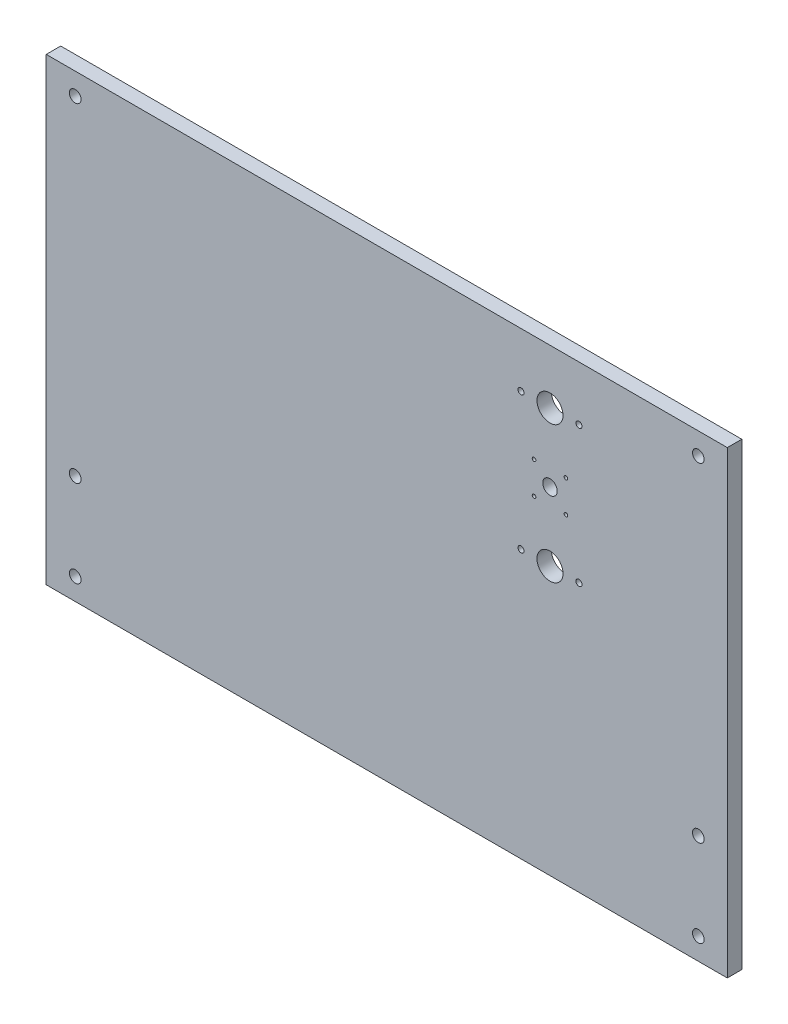
from build123d import *

# Parameters (mm, degrees)
SKETCH2_W             = 470
SKETCH2_H             = 317
BOSS_EXTRUDE1_DEPTH   = 5
SKETCH3_R             = 4.05
CUT_EXTRUDE1_DEPTH    = 10
SKETCH4_R             = 9
CUT_EXTRUDE2_DEPTH    = 284.632244288
M5X0_8_TAPPED_HOLE1_D = 4.2
SKETCH10_R            = 4
CUT_EXTRUDE8_DEPTH    = 284.632244288
SKETCH11_R            = 5
CUT_EXTRUDE9_DEPTH    = 284.632244288
M3X0_5_TAPPED_HOLE1_D = 2.5


with BuildPart() as part:
    # Sketch2 → Boss-Extrude1 (new, symmetric)
    with BuildSketch(Plane.XY):
        Rectangle(SKETCH2_W, SKETCH2_H)
    extrude(amount=BOSS_EXTRUDE1_DEPTH, both=True)

    # Sketch3 → Cut-Extrude1 (cut)
    with BuildSketch(Plane.XY.offset(5)):
        with Locations((-215, -83.5)):
            Circle(SKETCH3_R)
        with Locations((-215, -143.5)):
            Circle(SKETCH3_R)
        with Locations((215, -83.5)):
            Circle(SKETCH3_R)
        with Locations((215, -143.5)):
            Circle(SKETCH3_R)
        with Locations((-215, 143.5)):
            Circle(SKETCH3_R)
    extrude(amount=-CUT_EXTRUDE1_DEPTH, mode=Mode.SUBTRACT)

    # Sketch4 → Cut-Extrude2 (cut, through all)
    with BuildSketch(Plane.XY.offset(5)):
        with Locations((112.65, 121)):
            Circle(SKETCH4_R)
        with Locations((112.65, 26.5)):
            Circle(SKETCH4_R)
    extrude(amount=-CUT_EXTRUDE2_DEPTH, mode=Mode.SUBTRACT)

    # M5x0.8 Tapped Hole1 (through all)
    with Locations(Plane.XY.offset(5)):
        with Locations((132.65, 121), (92.65, 121), (92.65, 26.5), (132.65, 26.5)):
            Hole(M5X0_8_TAPPED_HOLE1_D / 2)

    # Sketch10 → Cut-Extrude8 (cut, through all)
    with BuildSketch(Plane.XY.offset(5)):
        with Locations((215, 143.5)):
            Circle(SKETCH10_R)
    extrude(amount=-CUT_EXTRUDE8_DEPTH, mode=Mode.SUBTRACT)

    # Sketch11 → Cut-Extrude9 (cut, through all)
    with BuildSketch(Plane.XY.offset(5)):
        with Locations((112.65, 73.75)):
            Circle(SKETCH11_R)
    extrude(amount=-CUT_EXTRUDE9_DEPTH, mode=Mode.SUBTRACT)

    # M3x0.5 Tapped Hole1 (through all)
    with Locations(Plane.XY.offset(5)):
        with Locations((101.65, 84.75), (123.65, 84.75), (123.65, 62.75), (101.65, 62.75)):
            Hole(M3X0_5_TAPPED_HOLE1_D / 2)


solid = part.part
